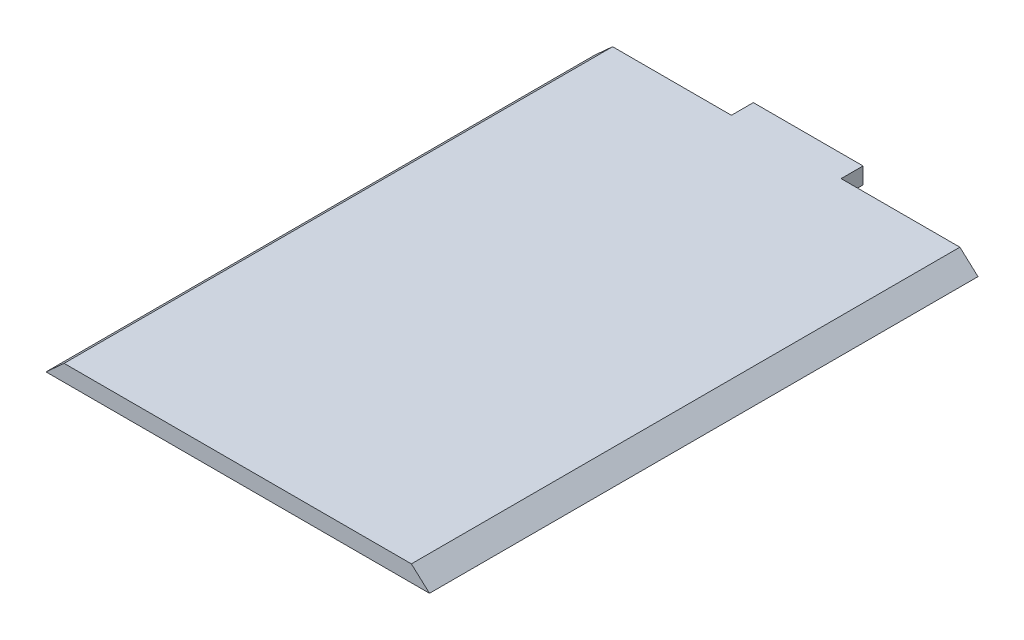
from build123d import *

# Parameters (mm, degrees)
BOSS_EXTRUDE1_DEPTH = 127
SKETCH2_W           = 25.4
SKETCH2_H           = 5.08
BOSS_EXTRUDE2_DEPTH = 3.81


with BuildPart() as part:
    # Sketch1 → Boss-Extrude1 (new body)
    with BuildSketch(Plane.XY):
        Polygon((-40.203883769, 5.937788296), (40.203883769, 5.937788296), (44.399042974, 2.127788296), (-44.399042974, 2.127788296), align=None)
    extrude(amount=BOSS_EXTRUDE1_DEPTH)

    # Sketch2 → Boss-Extrude2 (add)
    with BuildSketch(Plane.XZ.offset(-2.127788296)):
        with Locations((0, -2.54)):
            Rectangle(SKETCH2_W, SKETCH2_H)
    extrude(amount=-BOSS_EXTRUDE2_DEPTH)


solid = part.part
